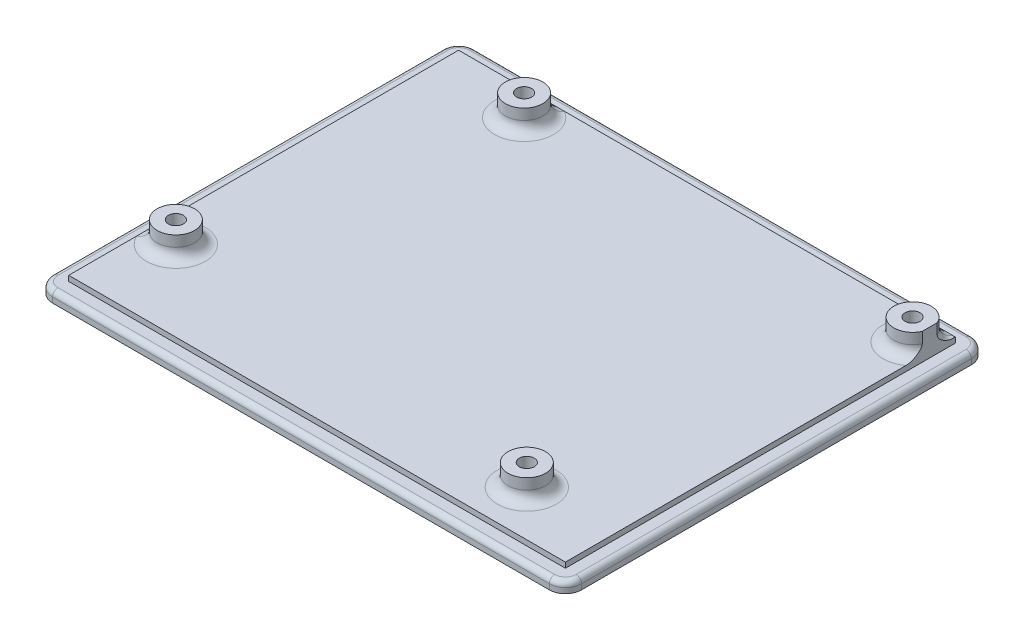
from build123d import *

# Parameters (mm, degrees)
SKETCH_1_W          = 92.71
SKETCH_1_H          = 72.77
EXTRUDE_1_DEPTH     = 3
SKETCH_2_R          = 3.5
SKETCH_2_R_2        = 1.1
EXTRUDE_2_DEPTH     = 4
SKETCH_3_R          = 1.4
CUT_EXTRUDE_1_DEPTH = 3
FILLET_1_R          = 2
CUT_EXTRUDE_START   = -3
SKETCH_5_R          = 1.1
CUT_EXTRUDE_2_DEPTH = 3
SKETCH_6_W          = 98.71
SKETCH_6_H          = 78.77
SKETCH_6_W_2        = 92.71
SKETCH_6_H_2        = 72.77
EXTRUDE_3_DEPTH     = 2
FILLET_2_R          = 3
FILLET_4_R          = 1


with BuildPart() as part:
    # Эскиз1 → Бобышка-Вытянуть1 (new body)
    with BuildSketch(Plane(origin=(0, 0, 0), x_dir=(1, 0, 0), z_dir=(0, 1, 0))):
        with Locations((46.355, 36.385)):
            Rectangle(SKETCH_1_W, SKETCH_1_H)
    extrude(amount=EXTRUDE_1_DEPTH)

    # Эскиз2 → Бобышка-Вытянуть2 (add)
    # profile 1 of 4: a face of its own
    with BuildSketch(Plane(origin=(0, 3, 0), x_dir=(1, 0, 0), z_dir=(0, 1, 0))):
        with Locations((17, 68)):
            Circle(SKETCH_2_R)
        with Locations((17, 68)):
            Circle(SKETCH_2_R_2, mode=Mode.SUBTRACT)
    # profile 2 of 4: a face of its own
    with BuildSketch(Plane(origin=(0, 3, 0), x_dir=(1, 0, 0), z_dir=(0, 1, 0))):
        with Locations((5, 15)):
            Circle(SKETCH_2_R)
        with Locations((5, 15)):
            Circle(SKETCH_2_R_2, mode=Mode.SUBTRACT)
    # profile 3 of 4: a face of its own
    with BuildSketch(Plane(origin=(0, 3, 0), x_dir=(1, 0, 0), z_dir=(0, 1, 0))):
        with Locations((77, 8.5)):
            Circle(SKETCH_2_R)
        with Locations((77, 8.5)):
            Circle(SKETCH_2_R_2, mode=Mode.SUBTRACT)
    # profile 4 of 4: a face of its own
    with BuildSketch(Plane(origin=(0, 3, 0), x_dir=(1, 0, 0), z_dir=(0, 1, 0))):
        with BuildLine():
            Line((92.71, 66.605044804), (92.71, 69.394955196))
            ThreePointArc((92.71, 69.394955196), (86, 68), (92.71, 66.605044804))
        make_face()
        with Locations((89.5, 68)):
            Circle(SKETCH_2_R_2, mode=Mode.SUBTRACT)
    extrude(amount=EXTRUDE_2_DEPTH)

    # Эскиз3 → Вырез-Вытянуть1 (cut)
    with BuildSketch(Plane(origin=(0, 7, 0), x_dir=(1, 0, 0), z_dir=(0, 1, 0))):
        with Locations((17, 68)):
            Circle(SKETCH_3_R)
        with Locations((89.5, 68)):
            Circle(SKETCH_3_R)
        with Locations((77, 8.5)):
            Circle(SKETCH_3_R)
        with Locations((5, 15)):
            Circle(SKETCH_3_R)
    extrude(amount=-CUT_EXTRUDE_1_DEPTH, mode=Mode.SUBTRACT)

    # Скругление1
    fillet_1_edges = [part.edges().sort_by_distance(p)[0] for p in [
        (1.5, 3, -15),
        (73.5, 3, -8.5),
        (86, 3, -68),
        (13.5, 3, -68),
    ]]
    fillet(fillet_1_edges, radius=FILLET_1_R)

    # Эскиз5 → Вырез-Вытянуть2 (cut)
    with BuildSketch(Plane(origin=(0, 3, 0), x_dir=(1, 0, 0), z_dir=(0, 1, 0)).offset(CUT_EXTRUDE_START)):
        with Locations((77, 8.5)):
            Circle(SKETCH_5_R)
        with Locations((5, 15)):
            Circle(SKETCH_5_R)
        with Locations((17, 68)):
            Circle(SKETCH_5_R)
        with Locations((89.5, 68)):
            Circle(SKETCH_5_R)
    extrude(amount=CUT_EXTRUDE_2_DEPTH, mode=Mode.SUBTRACT)

    # Эскиз6 → Бобышка-Вытянуть3 (add)
    with BuildSketch(Plane.XZ):
        with Locations((46.355, -36.385)):
            Rectangle(SKETCH_6_W, SKETCH_6_H)
        with Locations((46.355, -36.385)):
            Rectangle(SKETCH_6_W_2, SKETCH_6_H_2, mode=Mode.SUBTRACT)
    extrude(amount=-EXTRUDE_3_DEPTH)

    # Скругление2
    fillet_2_edges = [part.edges().sort_by_distance(p)[0] for p in [
        (-3, 1, -75.77),
        (-3, 1, 3),
        (95.71, 1, 3),
        (95.71, 1, -75.77),
    ]]
    fillet(fillet_2_edges, radius=FILLET_2_R)

    # Скругление4
    fillet_4_edges = [part.edges().sort_by_distance(p)[0] for p in [
        (94.831320344, 2, 2.121320344),
        (95.71, 2, -36.385),
        (94.831320344, 2, -74.891320344),
        (46.355, 2, -75.77),
        (-2.121320344, 2, -74.891320344),
        (-3, 2, -36.385),
        (-2.121320344, 2, 2.121320344),
        (46.355, 2, 3),
    ]]
    fillet(fillet_4_edges, radius=FILLET_4_R)


solid = part.part
